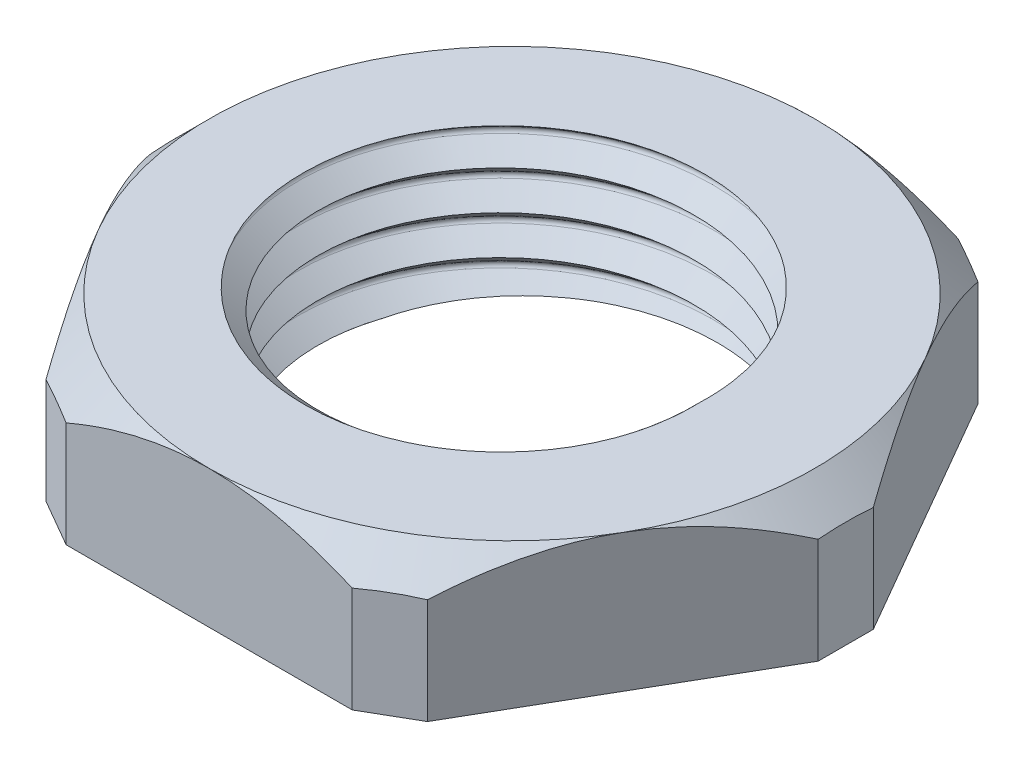
from build123d import *

# Parameters (mm, degrees)
PROFILE_DEPTH               = 2.5
MINORDIAREF_R               = 6.834894194
THRUHOLE_DEPTH              = 18.530925056
LOCKNUTTHREAD_PITCH         = 1.411
TOPCHAMFERS_OUTSIDE_W       = 71.26
TOPCHAMFERS_OUTSIDE_H       = 67.856
TOPCHAMFERS_OUTSIDE_R       = 11
TOPCHAMFER_DEPTH            = 18.53092522
TOPCHAMFER_DRAFT            = -45
CORNERFLAT_DEPTH            = 17.987740832
CIRPATTERN1_COUNT           = 6
EJECTIONPINHOLES_R          = 0.7
EJECTIONPINHOLE_DEPTH       = 1
EJECTIONPINHOLE_DRAFT       = -5
CIRPATTERN2_COPY_1_SKETCH_R = 0.7
CIRPATTERN2_COPY_1_DEPTH    = 1
CIRPATTERN2_COPY_1_DRAFT    = -5
CIRPATTERN2_COPY_2_SKETCH_R = 0.7
CIRPATTERN2_COPY_2_DEPTH    = 1
CIRPATTERN2_COPY_2_DRAFT    = -5


with BuildPart() as part:
    # ProfileS → Profile (new, symmetric)
    with BuildSketch(Plane(origin=(0, 0, 0), x_dir=(1, 0, 0), z_dir=(0, 1, 0))):
        Polygon((6.350852961, -11), (12.701705922, 0), (6.350852961, 11), (-6.350852961, 11), (-12.701705922, 0), (-6.350852961, -11), align=None)
    extrude(amount=PROFILE_DEPTH, both=True)

    # MinorDiaRef → ThruHole (cut, through all)
    with BuildSketch(Plane(origin=(0, 2.5, 0), x_dir=(-1, 0, 0), z_dir=(0, 1, 0))):
        with Locations(Location((0, 0, 0), (0, 0, 90))):
            Circle(MINORDIAREF_R)
    extrude(amount=-THRUHOLE_DEPTH, mode=Mode.SUBTRACT)

    # LockNutThread: arcs per turn and ends read off the stored shape
    # LockNutThread: the profile of LockNutThreadProfile screwed along a right-hand helix through 6 turns, 8 arcs to a turn; built about Z, then put on its axis
    locknutthread_z = Axis((0, 0, 0), (0, 0, 1))
    locknutthread_corners = [(6.834894194, 0, -2.1165), (7.537843982, 0, -1.526655092), (7.591774837, 0, -1.411), (7.537843982, 0, -1.295344908), (6.834894194, 0, -0.7055), (6.75921784, 0, -0.642), (6.75921784, 0, -2.18)]
    with BuildLine(mode=Mode.PRIVATE) as locknutthread_profile:
        Line(locknutthread_corners[0], locknutthread_corners[1])
        Line(locknutthread_corners[3], locknutthread_corners[4])
        Line(locknutthread_corners[4], locknutthread_corners[5])
        Line(locknutthread_corners[5], locknutthread_corners[6])
        Line(locknutthread_corners[6], locknutthread_corners[0])
        ThreePointArc((7.537843982, 0, -1.526655092), (7.577629468, 0, -1.474805637), (7.591774837, 0, -1.411))
        ThreePointArc((7.591774837, 0, -1.411), (7.577629468, 0, -1.347194363), (7.537843982, 0, -1.295344908))
    locknutthread_cap = Face(locknutthread_profile.wire())
    locknutthread_arcs = [((7.537843982, 0, -1.526655092), (7.591774837, 0, -1.481401731), (7.591774837, 0, -1.411), (1, 0.9063077870366494, 1)), ((7.591774837, 0, -1.411), (7.591774837, 0, -1.340598269), (7.537843982, 0, -1.295344908), (1, 0.9063077870366494, 1))]  # start, shoulder, end, weights
    locknutthread_turn_angles = [0, 22.5, 45, 67.5, 90, 112.5, 135, 157.5, 180, 202.5, 225, 247.5, 270, 292.5, 315, 337.5, 360]
    locknutthread_turn_weights = [1, 0.9238795325112867, 1, 0.9238795325112867, 1, 0.9238795325112867, 1, 0.9238795325112867, 1, 0.9238795325112867, 1, 0.9238795325112867, 1, 0.9238795325112867, 1, 0.9238795325112867, 1]
    locknutthread_turn_rails = [Edge.make_bspline([Vector(p[0], p[1], 0).rotate(locknutthread_z, locknutthread_turn_angles[k]) / locknutthread_turn_weights[k] + Vector(0, 0, p[2] + LOCKNUTTHREAD_PITCH * locknutthread_turn_angles[k] / 360) for k in range(17)], [0, 0, 0, 1, 1, 2, 2, 3, 3, 4, 4, 5, 5, 6, 6, 7, 7, 8, 8, 8], 2, locknutthread_turn_weights) for p in locknutthread_corners]
    locknutthread_turn_sides = [*[Face.make_surface_from_curves(locknutthread_turn_rails[p[0]], locknutthread_turn_rails[p[1]]) for p in [(0, 1), (3, 4), (4, 5), (5, 6), (6, 0)]], *[Face.make_bezier_surface([[Vector(p[j][0], p[j][1], 0).rotate(locknutthread_z, locknutthread_turn_angles[2 * i + k]) / locknutthread_turn_weights[2 * i + k] + Vector(0, 0, p[j][2] + LOCKNUTTHREAD_PITCH * locknutthread_turn_angles[2 * i + k] / 360) for k in range(3)] for j in range(3)], [[p[3][j] * locknutthread_turn_weights[2 * i + k] for k in range(3)] for j in range(3)]) for p in locknutthread_arcs for i in range(8)]]
    locknutthread_turn = Solid(Shell([*locknutthread_turn_sides, locknutthread_cap, locknutthread_cap.rotate(locknutthread_z, 360).moved(Location((0, 0, LOCKNUTTHREAD_PITCH * 360 / 360)))]))
    locknutthread_each = [*[locknutthread_turn.moved(Location((0, 0, LOCKNUTTHREAD_PITCH * i))) for i in range(6)]]
    add(Plane(origin=(0, 2.5, 0), x_dir=(-1, 0, 0), z_dir=(0, -1, 0)) * Compound([locknutthread_each[i] for i in range(0, 6, 2)]), mode=Mode.SUBTRACT)
    add(Plane(origin=(0, 2.5, 0), x_dir=(-1, 0, 0), z_dir=(0, -1, 0)) * Compound([locknutthread_each[i] for i in range(1, 6, 2)]), mode=Mode.SUBTRACT)


with BuildPart() as topchamfer_tool:
    # TopChamferS outside → TopChamfer (with draft: the straight prism first)
    with BuildSketch(Plane(origin=(0, 2.5, 0), x_dir=(1, 0, 0), z_dir=(0, 1, 0))):
        Rectangle(TOPCHAMFERS_OUTSIDE_W, TOPCHAMFERS_OUTSIDE_H)
        Circle(TOPCHAMFERS_OUTSIDE_R, mode=Mode.SUBTRACT)
    extrude(amount=-TOPCHAMFER_DEPTH)
    # TopChamfer: the draft: its side faces are tilted about the plane it starts from
    topchamfer_sides = [topchamfer_tool.faces().sort_by_distance(p)[0] for p in [
        (0, -6.76546261, 33.928),
        (35.63, -6.76546261, 0),
        (0, -6.76546261, -33.928),
        (-35.63, -6.76546261, 0),
        (-11, -6.76546261, 0),
    ]]
    draft(topchamfer_sides, Plane(origin=(0, 2.5, 0), x_dir=(1, 0, 0), z_dir=(0, 1, 0)), TOPCHAMFER_DRAFT)


with BuildPart() as part_1:
    add(part.part)

    # TopChamfer: cut by topchamfer_tool
    add(topchamfer_tool.part, mode=Mode.SUBTRACT)

    # CornerFlatS → CornerFlat (cut, symmetric)
    with BuildSketch(Plane(origin=(0, 0, 0), x_dir=(1, 0, 0), z_dir=(0, 1, 0))):
        Polygon((53.253658998, 44.746014358), (-5.196152423, 11), (-6.92820323, 10), (-65.378014651, -23.746014358), (-132.870043367, 93.153608484), (-14.238369718, 161.645637199), align=None)
    cornerflat = extrude(amount=CORNERFLAT_DEPTH, both=True, mode=Mode.SUBTRACT)

    # CirPattern1: CornerFlat ×6 about axis
    cirpattern1_axis = Axis((0, 0, 0), (0, 1, 0))
    for i in range(1, CIRPATTERN1_COUNT):
        add(cornerflat.rotate(cirpattern1_axis, i * 360 / CIRPATTERN1_COUNT), mode=Mode.SUBTRACT)


with BuildPart() as ejectionpinhole_tool:
    # EjectionPinHoleS → EjectionPinHole (with draft: the straight prism first)
    with BuildSketch(Plane(origin=(0, -2.5, 0), x_dir=(-1, 0, 0), z_dir=(0, -1, 0))):
        with Locations((4.931088913, -8.540896534)):
            Circle(EJECTIONPINHOLES_R)
    extrude(amount=-EJECTIONPINHOLE_DEPTH)
    # EjectionPinHole: the draft: its side faces are tilted about the plane it starts from
    ejectionpinhole_sides = [ejectionpinhole_tool.faces().sort_by_distance(p)[0] for p in [
        (-4.231088913, -2, 8.540896534),
    ]]
    draft(ejectionpinhole_sides, Plane(origin=(0, -2.5, 0), x_dir=(-1, 0, 0), z_dir=(0, -1, 0)), EJECTIONPINHOLE_DRAFT)


with BuildPart() as part_2:
    add(part_1.part)

    # EjectionPinHole: cut by ejectionpinhole_tool
    add(ejectionpinhole_tool.part, mode=Mode.SUBTRACT)


with BuildPart() as cirpattern2_copy_1_tool:
    # CirPattern2 copy 1 sketch → CirPattern2 copy 1 (with draft: the straight prism first)
    with BuildSketch(Plane(origin=(0, -2.5, 0), x_dir=(0.4999999999999998, 0, 0.8660254037844387), z_dir=(0, -1, 0))):
        with Locations((4.931088913, -8.540896534)):
            Circle(CIRPATTERN2_COPY_1_SKETCH_R)
    extrude(amount=-CIRPATTERN2_COPY_1_DEPTH)
    # CirPattern2 copy 1: the draft: its side faces are tilted about the plane it starts from
    cirpattern2_copy_1_sides = [cirpattern2_copy_1_tool.faces().sort_by_distance(p)[0] for p in [
        (9.512177826, -2, -0.606217783),
    ]]
    draft(cirpattern2_copy_1_sides, Plane(origin=(0, -2.5, 0), x_dir=(0.4999999999999998, 0, 0.8660254037844387), z_dir=(0, -1, 0)), CIRPATTERN2_COPY_1_DRAFT)


with BuildPart() as part_3:
    add(part_2.part)

    # CirPattern2 copy 1: cut by cirpattern2_copy_1_tool
    add(cirpattern2_copy_1_tool.part, mode=Mode.SUBTRACT)


with BuildPart() as cirpattern2_copy_2_tool:
    # CirPattern2 copy 2 sketch → CirPattern2 copy 2 (with draft: the straight prism first)
    with BuildSketch(Plane(origin=(0, -2.5, 0), x_dir=(0.5000000000000004, 0, -0.8660254037844384), z_dir=(0, -1, 0))):
        with Locations((4.931088913, -8.540896534)):
            Circle(CIRPATTERN2_COPY_2_SKETCH_R)
    extrude(amount=-CIRPATTERN2_COPY_2_DEPTH)
    # CirPattern2 copy 2: the draft: its side faces are tilted about the plane it starts from
    cirpattern2_copy_2_sides = [cirpattern2_copy_2_tool.faces().sort_by_distance(p)[0] for p in [
        (-5.281088913, -2, -7.934678751),
    ]]
    draft(cirpattern2_copy_2_sides, Plane(origin=(0, -2.5, 0), x_dir=(0.5000000000000004, 0, -0.8660254037844384), z_dir=(0, -1, 0)), CIRPATTERN2_COPY_2_DRAFT)


with BuildPart() as part_4:
    add(part_3.part)

    # CirPattern2 copy 2: cut by cirpattern2_copy_2_tool
    add(cirpattern2_copy_2_tool.part, mode=Mode.SUBTRACT)


solid = part_4.part
